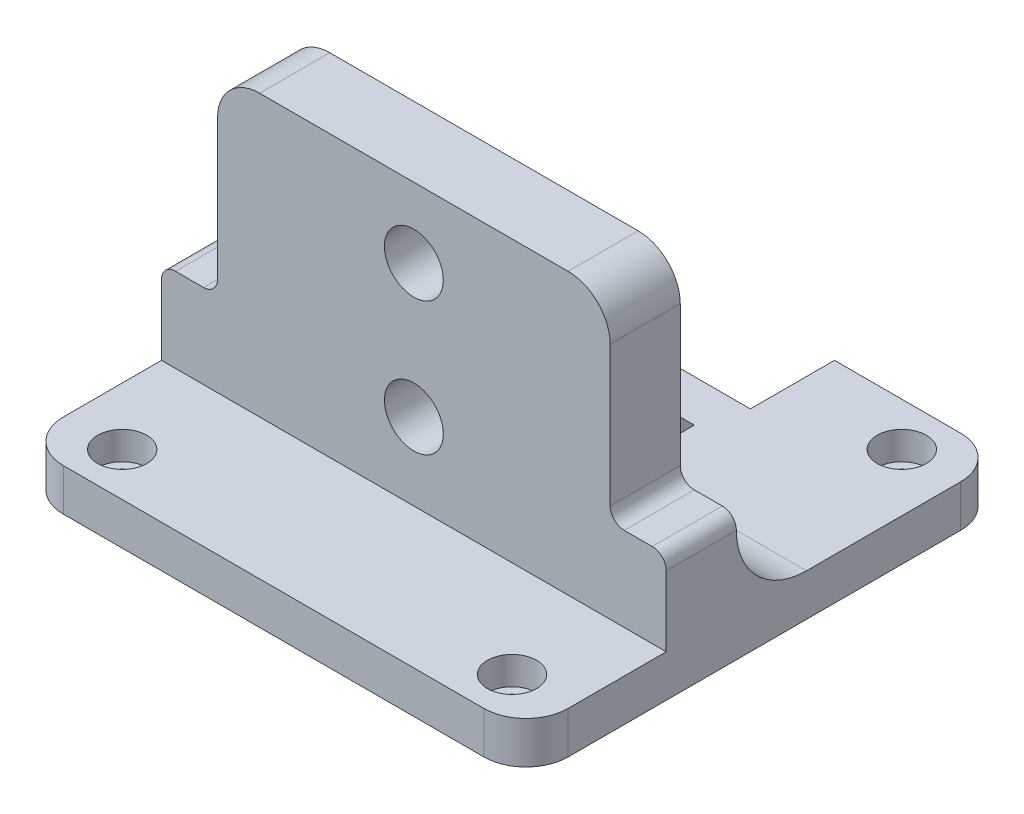
from build123d import *

# Parameters (mm, degrees)
EXTRUDE_1_DEPTH     = 3
SKETCH_3_W          = 36
SKETCH_3_H          = 5
EXTRUDE_3_DEPTH     = 6
SKETCH_4_W          = 28
SKETCH_4_H          = 5
EXTRUDE_4_DEPTH     = 14
SKETCH_6_W          = 2
SKETCH_6_H          = 10
EXTRUDE_6_DEPTH     = 10
CHAMFER_1_SIZE      = 10
FILLET_2_R          = 5
SKETCH_12_R         = 2.1
CUT_EXTRUDE_3_DEPTH = 38.802116343
SKETCH_2_R          = 1.1
CUT_EXTRUDE_4_DEPTH = 34.793490497
SKETCH_13_R         = 1.75
CUT_EXTRUDE_5_DEPTH = 2
FILLET_3_R          = 3
FILLET_4_R          = 1


with BuildPart() as part:
    # 草图1 → 凸台-拉伸1 (new body)
    with BuildSketch(Plane(origin=(0, 0, 0), x_dir=(1, 0, 0), z_dir=(0, 1, 0))):
        Polygon((6, 17), (18, 17), (18, -17), (-18, -17), (-18, 17), (-6, 17), (-6, 11), (6, 11), align=None)
    extrude(amount=EXTRUDE_1_DEPTH)

    # 草图3 → 凸台-拉伸3 (add)
    with BuildSketch(Plane(origin=(0, 3, 0), x_dir=(1, 0, 0), z_dir=(0, 1, 0))):
        with Locations((0, -4.5)):
            Rectangle(SKETCH_3_W, SKETCH_3_H)
    extrude(amount=EXTRUDE_3_DEPTH)

    # 草图4 → 凸台-拉伸4 (add)
    with BuildSketch(Plane(origin=(0, 9, 0), x_dir=(1, 0, 0), z_dir=(0, 1, 0))):
        with Locations((0, -4.5)):
            Rectangle(SKETCH_4_W, SKETCH_4_H)
    extrude(amount=EXTRUDE_4_DEPTH)

    # 草图6 → 凸台-拉伸6 (add)
    with BuildSketch(Plane(origin=(0, 3, 0), x_dir=(1, 0, 0), z_dir=(0, 1, 0))):
        with Locations((4, 3)):
            Rectangle(SKETCH_6_W, SKETCH_6_H)
        with Locations((-4, 3)):
            Rectangle(SKETCH_6_W, SKETCH_6_H)
    extrude(amount=EXTRUDE_6_DEPTH)

    # 倒角1
    chamfer_1_edges = [part.edges().sort_by_distance(p)[0] for p in [
        (4, 13, -8),
        (-4, 13, -8),
    ]]
    chamfer(chamfer_1_edges, length=CHAMFER_1_SIZE - 0.0001)  # a hair under: the kernel refuses the full size

    # 圆角2
    fillet_2_edges = [part.edges().sort_by_distance(p)[0] for p in [
        (11.5, 3, 2),
        (0, 3, 2),
        (-11.5, 3, 2),
    ]]
    fillet(fillet_2_edges, radius=FILLET_2_R)

    # 草图12 → 切除-拉伸3 (cut, through all)
    with BuildSketch(Plane.XY.offset(7)):
        with Locations((0, 18)):
            Circle(SKETCH_12_R)
        with Locations((0, 8.5)):
            Circle(SKETCH_12_R)
    extrude(amount=-CUT_EXTRUDE_3_DEPTH, mode=Mode.SUBTRACT)

    # 草图2 → 切除-拉伸4 (cut, through all)
    with BuildSketch(Plane.XZ):
        with Locations(Location((-13.9, 13.9, 0), (0, 0, 270))):
            Circle(SKETCH_2_R)
        with Locations(Location((13.9, 13.9, 0), (0, 0, 270))):
            Circle(SKETCH_2_R)
        with Locations(Location((-13.9, -13.9, 0), (0, 0, 270))):
            Circle(SKETCH_2_R)
        with Locations(Location((13.9, -13.9, 0), (0, 0, 270))):
            Circle(SKETCH_2_R)
    extrude(amount=-CUT_EXTRUDE_4_DEPTH, mode=Mode.SUBTRACT)

    # 草图13 → 切除-拉伸5 (cut)
    with BuildSketch(Plane(origin=(0, 3, 0), x_dir=(1, 0, 0), z_dir=(0, 1, 0))):
        with Locations(Location((-13.9, 13.9, 0), (0, 0, 270))):
            Circle(SKETCH_13_R)
        with Locations(Location((13.9, 13.9, 0), (0, 0, 270))):
            Circle(SKETCH_13_R)
        with Locations(Location((-13.9, -13.9, 0), (0, 0, 270))):
            Circle(SKETCH_13_R)
        with Locations(Location((13.9, -13.9, 0), (0, 0, 270))):
            Circle(SKETCH_13_R)
    extrude(amount=-CUT_EXTRUDE_5_DEPTH, mode=Mode.SUBTRACT)

    # 圆角3
    fillet_3_edges = [part.edges().sort_by_distance(p)[0] for p in [
        (-18, 1.5, -17),
        (18, 1.5, -17),
        (18, 1.5, 17),
        (-18, 1.5, 17),
        (-14, 23, 4.5),
        (14, 23, 4.5),
    ]]
    fillet(fillet_3_edges, radius=FILLET_3_R)

    # 圆角4
    fillet_4_edges = [part.edges().sort_by_distance(p)[0] for p in [
        (18, 9, 4.5),
        (14, 9, 4.5),
        (-18, 9, 4.5),
        (-14, 9, 4.5),
    ]]
    fillet(fillet_4_edges, radius=FILLET_4_R)


solid = part.part
